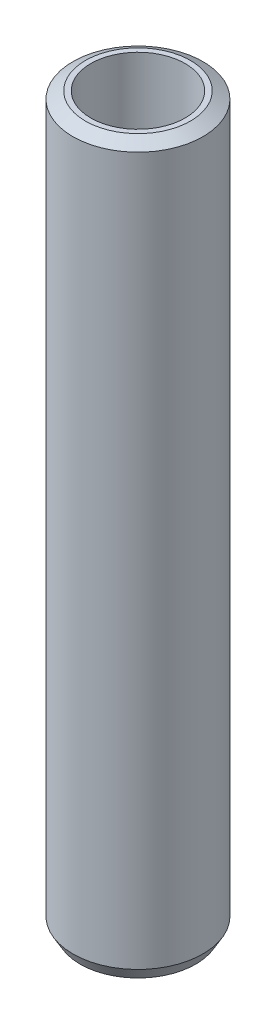
from build123d import *
from OCP.BRepFilletAPI import BRepFilletAPI_MakeChamfer

# Parameters (mm, degrees)
SKETCH1_R           = 50
BOSS_EXTRUDE1_DEPTH = 559.124205596
SKETCH2_R           = 36.284461909
CUT_EXTRUDE1_DEPTH  = 564.577747328
CHAMFER1_SIZE       = 5.560094699
CHAMFER1_SIZE2      = 9.630366513


with BuildPart() as part:
    # Sketch1 → Boss-Extrude1 (new body)
    with BuildSketch(Plane(origin=(0, 0, 0), x_dir=(1, 0, 0), z_dir=(0, 1, 0))):
        Circle(SKETCH1_R)
    extrude(amount=BOSS_EXTRUDE1_DEPTH)

    # Sketch2 → Cut-Extrude1 (cut, through all)
    with BuildSketch(Plane(origin=(0, 0, 0), x_dir=(1, 0, 0), z_dir=(0, 1, 0))):
        Circle(SKETCH2_R)
    extrude(amount=CUT_EXTRUDE1_DEPTH, mode=Mode.SUBTRACT)

    # Chamfer1: one chamfer whose edges measure the first distance from different faces: ONE call of the kernel's chamfer builder (chamfer() names one face for all edges)
    chamfer1_edges_1 = [part.edges().sort_by_distance(p)[0] for p in [
        (-50, 559.124205596, 0),
    ]]
    chamfer1_side_1 = [part.faces().sort_by_distance(p)[0] for p in [
        (-50, 279.562102798, 0),
    ]]
    chamfer1_edges_2 = [part.edges().sort_by_distance(p)[0] for p in [
        (-50, 0, 0),
    ]]
    chamfer1_side_2 = [part.faces().sort_by_distance(p)[0] for p in [
        (-48.585786438, 0, 0),
    ]]
    chamfer1 = BRepFilletAPI_MakeChamfer(part.part.solid().wrapped)
    for e in chamfer1_edges_1:
        chamfer1.Add(CHAMFER1_SIZE, CHAMFER1_SIZE2, e.wrapped, chamfer1_side_1[0].wrapped)  # the first distance lies on this face
    for e in chamfer1_edges_2:
        chamfer1.Add(CHAMFER1_SIZE, CHAMFER1_SIZE2, e.wrapped, chamfer1_side_2[0].wrapped)  # the first distance lies on this face
    add(Compound.cast(chamfer1.Shape()), mode=Mode.REPLACE)


solid = part.part
